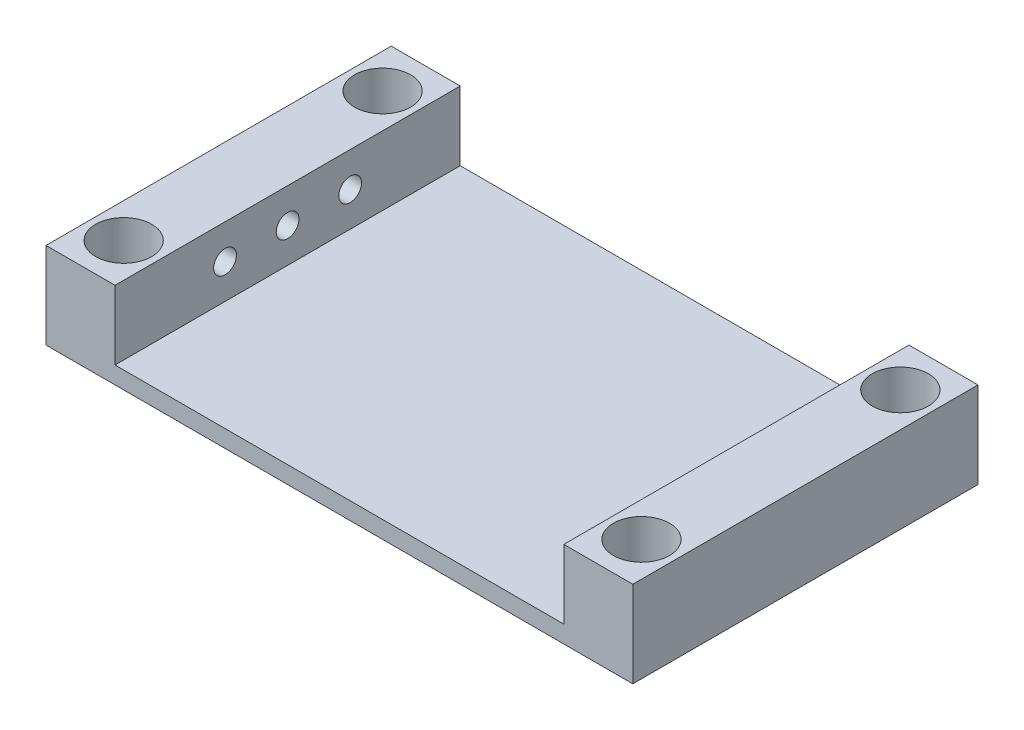
from build123d import *

# Parameters (mm, degrees)
BOSS_EXTRUDE1_DEPTH = 40
SKETCH3_R           = 3.25
CUT_EXTRUDE1_DEPTH  = 8
SKETCH4_R           = 2
CUT_EXTRUDE2_DEPTH  = 8
CUT_EXTRUDE3_REACH  = 81.524
SKETCH5_R           = 1.32
SKETCH6_R           = 3.25
CUT_EXTRUDE4_DEPTH  = 6


with BuildPart() as part:
    # Sketch1 → Boss-Extrude1 (new body)
    with BuildSketch(Plane.XY):
        Polygon((-68, 0), (-68, 10), (-60, 10), (-60, 2), (-8, 2), (-8, 10), (0, 10), (0, 0), align=None)
    extrude(amount=BOSS_EXTRUDE1_DEPTH)

    # Sketch3 → Cut-Extrude1 (cut)
    with BuildSketch(Plane(origin=(0, 10, 0), x_dir=(1, 0, 0), z_dir=(0, 1, 0))):
        with Locations((-64, -5)):
            Circle(SKETCH3_R)
        with Locations((-4, -5)):
            Circle(SKETCH3_R)
        with Locations((-4, -35)):
            Circle(SKETCH3_R)
        with Locations((-64, -35)):
            Circle(SKETCH3_R)
    extrude(amount=-CUT_EXTRUDE1_DEPTH, mode=Mode.SUBTRACT)

    # Sketch4 → Cut-Extrude2 (cut)
    with BuildSketch(Plane.XZ):
        with Locations((-64, 35)):
            Circle(SKETCH4_R)
        with Locations((-4, 35)):
            Circle(SKETCH4_R)
        with Locations((-4, 5)):
            Circle(SKETCH4_R)
        with Locations((-64, 5)):
            Circle(SKETCH4_R)
    extrude(amount=-CUT_EXTRUDE2_DEPTH, mode=Mode.SUBTRACT)

    # Sketch5 → Cut-Extrude3 (cut, up to next)
    with BuildSketch(Plane.ZY.offset(68), mode=Mode.PRIVATE) as cut_extrude3_sk1:
        with Locations((12.75, 6)):
            Circle(SKETCH5_R)
    cut_extrude3_tool1 = extrude(cut_extrude3_sk1.sketch, amount=-CUT_EXTRUDE3_REACH, mode=Mode.PRIVATE) & part.part
    # Sketch5 → Cut-Extrude3 (cut, up to next)
    with BuildSketch(Plane.ZY.offset(68), mode=Mode.PRIVATE) as cut_extrude3_sk2:
        with Locations((20, 6)):
            Circle(SKETCH5_R)
    cut_extrude3_tool2 = extrude(cut_extrude3_sk2.sketch, amount=-CUT_EXTRUDE3_REACH, mode=Mode.PRIVATE) & part.part
    # Sketch5 → Cut-Extrude3 (cut, up to next)
    with BuildSketch(Plane.ZY.offset(68), mode=Mode.PRIVATE) as cut_extrude3_sk3:
        with Locations((27.25, 6)):
            Circle(SKETCH5_R)
    cut_extrude3_tool3 = extrude(cut_extrude3_sk3.sketch, amount=-CUT_EXTRUDE3_REACH, mode=Mode.PRIVATE) & part.part
    add(cut_extrude3_tool1.solids().sort_by_distance((-68, 6, 12.75))[0], mode=Mode.SUBTRACT)
    add(cut_extrude3_tool2.solids().sort_by_distance((-68, 6, 20))[0], mode=Mode.SUBTRACT)
    add(cut_extrude3_tool3.solids().sort_by_distance((-68, 6, 27.25))[0], mode=Mode.SUBTRACT)

    # Sketch6 → Cut-Extrude4 (cut)
    with BuildSketch(Plane.ZY.offset(68)):
        with Locations((12.75, 6)):
            Circle(SKETCH6_R)
        with Locations((20, 6)):
            Circle(SKETCH6_R)
        with Locations((27.25, 6)):
            Circle(SKETCH6_R)
    extrude(amount=-CUT_EXTRUDE4_DEPTH, mode=Mode.SUBTRACT)


solid = part.part
